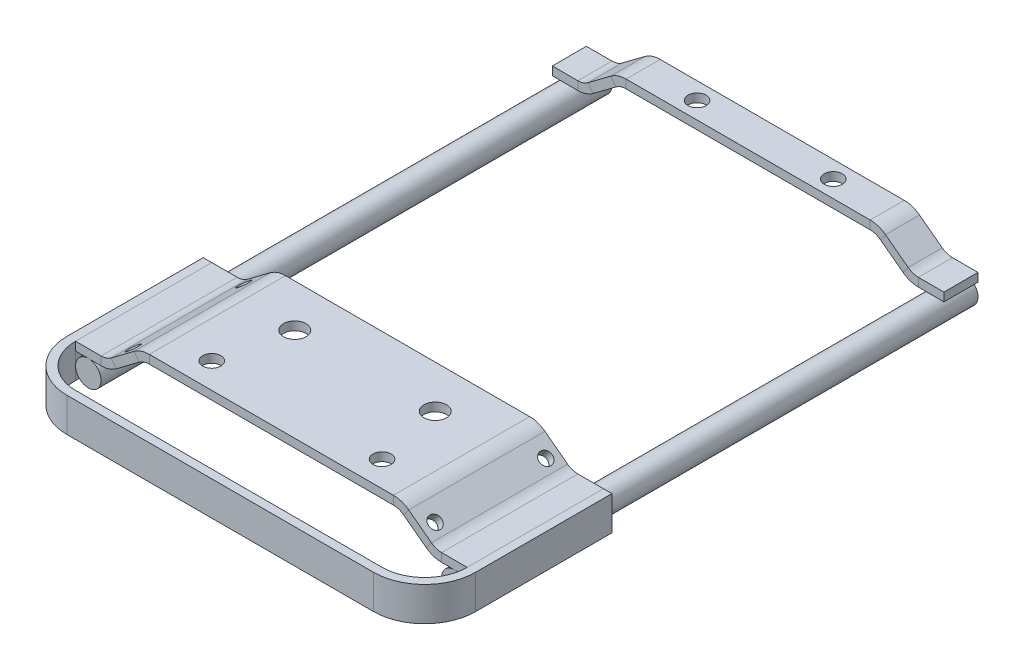
from build123d import *

# Parameters (mm, degrees)
BOSS_EXTRUDE1_DEPTH                     = 50.8
BOSS_EXTRUDE3_DEPTH                     = 12.7
SKETCH475_R                             = 4.7625
BOSS_EXTRUDE4_DEPTH                     = 190.5
BOSS_EXTRUDE4_2_DEPTH                   = 190.5
BOSS_EXTRUDE5_DEPTH                     = 12.7
SKETCH480_W                             = 4.2164
SKETCH480_H                             = 22.225
F_5_16_CLEARANCE_HOLE1_AT_2_COUNT       = 2
F_5_16_CLEARANCE_HOLE1_AT_2_PITCH       = 52.3875
SKETCH482_W                             = 3.3782
SKETCH482_H                             = 22.225
F_1_4_CLEARANCE_HOLE1_AT_2_COUNT        = 2
F_1_4_CLEARANCE_HOLE1_AT_2_PITCH        = 63.5
F_1_4_CLEARANCE_HOLE1_AT_3_COUNT        = 2
F_1_4_CLEARANCE_HOLE1_AT_3_PITCH        = 174.740416404
F_1_4_CLEARANCE_HOLE1_AT_4_COUNT        = 2
F_1_4_CLEARANCE_HOLE1_AT_4_PITCH        = 183.738980962
SKETCH484_W                             = 2.38125
SKETCH484_H                             = 83.185
F_3_16_0_1875_DIAMETER_HOLE1_AT_2_COUNT = 2
F_3_16_0_1875_DIAMETER_HOLE1_AT_2_PITCH = 41.275
MIRROR1_COPY_1_SKETCH_W                 = 2.38125
MIRROR1_COPY_1_SKETCH_H                 = 83.185
CONVERT_SOLID1_START                    = -50.8
CONVERT_SOLID1_DEPTH                    = 50.8
CONVERT_SOLID1_2_DEPTH                  = 50.8
CONVERT_SOLID2_START                    = -190.5
CONVERT_SOLID2_DEPTH                    = 12.7
CONVERT_SOLID2_2_DEPTH                  = 12.7


# Read off the part's stored shape, not the designer's step: Convert-Solid1, Convert-Solid2
with BuildPart() as part:
    # Sketch1 → Boss-Extrude1 (new body)
    with BuildSketch(Plane.XY):
        Polygon((0, 7.9375), (47.625, 7.9375), (60.325, -1.5875), (73.025, -1.5875), (73.025, 1.5875), (61.383333333, 1.5875), (48.683333333, 11.1125), (0, 11.1125), (-48.683333333, 11.1125), (-61.383333333, 1.5875), (-73.025, 1.5875), (-73.025, -1.5875), (-60.325, -1.5875), (-47.625, 7.9375), align=None)
    extrude(amount=-BOSS_EXTRUDE1_DEPTH)

    # Sketch480 → 5/16 Clearance Hole1 (revolve, cut)
    with BuildSketch(Plane(origin=(-26.19375, 11.1125, -34.925), x_dir=(0, 0, 1), z_dir=(1, 0, 0))):
        with Locations((2.1082, 11.1125)):
            Rectangle(SKETCH480_W, SKETCH480_H)
    f_5_16_clearance_hole1 = revolve(axis=Axis((-26.19375, 17.4625, -34.925), (0, -1, 0)), mode=Mode.SUBTRACT)

    # 5/16 Clearance Hole1 at 2: 5/16 Clearance Hole1 ×2
    with Locations(*[(i * F_5_16_CLEARANCE_HOLE1_AT_2_PITCH, 0, 0) for i in range(1, F_5_16_CLEARANCE_HOLE1_AT_2_COUNT)]):
        add(f_5_16_clearance_hole1, mode=Mode.SUBTRACT)

    # Sketch482 → 1/4 Clearance Hole1 (revolve, cut)
    with BuildSketch(Plane(origin=(-31.75, 11.1125, -9.525), x_dir=(0, 0, 1), z_dir=(1, 0, 0))):
        with Locations((1.6891, 11.1125)):
            Rectangle(SKETCH482_W, SKETCH482_H)
    f_1_4_clearance_hole1 = revolve(axis=Axis((-31.75, 17.4625, -9.525), (0, -1, 0)), mode=Mode.SUBTRACT)

    # 1/4 Clearance Hole1 at 2: 1/4 Clearance Hole1 ×2
    with Locations(*[(i * F_1_4_CLEARANCE_HOLE1_AT_2_PITCH, 0, 0) for i in range(1, F_1_4_CLEARANCE_HOLE1_AT_2_COUNT)]):
        add(f_1_4_clearance_hole1, mode=Mode.SUBTRACT)

    # Sketch484 → 3/16 (0.1875) Diameter Hole1 (revolve, cut)
    with BuildSketch(Plane(origin=(56.303333333, 5.3975, -46.0375), x_dir=(-0.7999999999999998, 0.6000000000000002, 0), z_dir=(0, 0, 1))):
        with Locations((1.190625, 41.5925)):
            Rectangle(SKETCH484_W, SKETCH484_H)
    f_3_16_0_1875_diameter_hole1 = revolve(axis=Axis((60.113333333, 10.4775, -46.0375), (-0.6000000000000003, -0.7999999999999998, 0)), mode=Mode.SUBTRACT)

    # 3/16 (0.1875) Diameter Hole1 at 2: 3/16 (0.1875) Diameter Hole1 ×2
    with Locations(*[(0, 0, i * F_3_16_0_1875_DIAMETER_HOLE1_AT_2_PITCH) for i in range(1, F_3_16_0_1875_DIAMETER_HOLE1_AT_2_COUNT)]):
        add(f_3_16_0_1875_diameter_hole1, mode=Mode.SUBTRACT)

    # Mirror1: 3/16 (0.1875) Diameter Hole1 across plane
    add(f_3_16_0_1875_diameter_hole1.mirror(Plane(origin=(0, 0, 0), x_dir=(0, 0, 1), z_dir=(1, 0, 0))), mode=Mode.SUBTRACT)

    # Mirror1 copy 1 sketch → Mirror1 copy 1 (revolve, cut)
    with BuildSketch(Plane(origin=(-56.303333333, 5.3975, -4.7625), x_dir=(0.7999999999999998, 0.6000000000000002, 0), z_dir=(0, 0, 1))):
        with Locations((1.190625, -41.5925)):
            Rectangle(MIRROR1_COPY_1_SKETCH_W, MIRROR1_COPY_1_SKETCH_H)
    revolve(axis=Axis((-60.113333333, 10.4775, -4.7625), (-0.6000000000000003, 0.7999999999999998, 0)), mode=Mode.SUBTRACT)

    # Convert-Solid1 outline → Convert-Solid1 (cut)
    with BuildSketch(Plane.XY.offset(CONVERT_SOLID1_START)):
        with BuildLine():
            ThreePointArc((63.5, -1.5875), (60.487930529, -1.098708414), (57.785, 0.3175))
            Line((57.785, 0.3175), (60.325, -1.5875))
            Line((60.325, -1.5875), (63.5, -1.5875))
        make_face()
        with BuildLine():
            Line((-60.325, -1.5875), (-57.785, 0.3175))
            ThreePointArc((-57.785, 0.3175), (-60.487930529, -1.098708414), (-63.5, -1.5875))
            Line((-63.5, -1.5875), (-60.325, -1.5875))
        make_face()
        with BuildLine():
            ThreePointArc((45.508333333, 11.1125), (48.520402804, 10.623708414), (51.223333333, 9.2075))
            Line((51.223333333, 9.2075), (48.683333333, 11.1125))
            Line((48.683333333, 11.1125), (45.508333333, 11.1125))
        make_face()
        with BuildLine():
            ThreePointArc((-51.223333333, 9.2075), (-48.520402804, 10.623708414), (-45.508333333, 11.1125))
            Line((-45.508333333, 11.1125), (-48.683333333, 11.1125))
            Line((-48.683333333, 11.1125), (-51.223333333, 9.2075))
        make_face()
    extrude(amount=CONVERT_SOLID1_DEPTH, mode=Mode.SUBTRACT)

    # Convert-Solid1 2 outline → Convert-Solid1 2 (add)
    with BuildSketch(Plane.XY.offset(CONVERT_SOLID1_START)):
        with BuildLine():
            Line((61.383333333, 1.5875), (63.5, 1.5875))
            ThreePointArc((63.5, 1.5875), (61.491953686, 1.913361057), (59.69, 2.8575))
            Line((59.69, 2.8575), (61.383333333, 1.5875))
        make_face()
        with BuildLine():
            ThreePointArc((45.508333333, 7.9375), (47.516379647, 7.611638943), (49.318333333, 6.6675))
            Line((49.318333333, 6.6675), (47.625, 7.9375))
            Line((47.625, 7.9375), (45.508333333, 7.9375))
        make_face()
        with BuildLine():
            Line((-47.625, 7.9375), (-49.318333333, 6.6675))
            ThreePointArc((-49.318333333, 6.6675), (-47.516379647, 7.611638943), (-45.508333333, 7.9375))
            Line((-45.508333333, 7.9375), (-47.625, 7.9375))
        make_face()
        with BuildLine():
            Line((-63.5, 1.5875), (-61.383333333, 1.5875))
            Line((-61.383333333, 1.5875), (-59.69, 2.8575))
            ThreePointArc((-59.69, 2.8575), (-61.491953686, 1.913361057), (-63.5, 1.5875))
        make_face()
    extrude(amount=CONVERT_SOLID1_2_DEPTH)


with BuildPart() as body_2:
    # Sketch474 → Boss-Extrude3 (new body)
    with BuildSketch(Plane(origin=(0, 1.5875, 0), x_dir=(1, 0, 0), z_dir=(0, 1, 0))):
        with BuildLine():
            Line((-73.025, 50.8), (-73.025, 0))
            ThreePointArc((-73.025, 0), (-68.375320151, -11.225320151), (-57.15, -15.875))
            Line((-57.15, -15.875), (57.15, -15.875))
            ThreePointArc((57.15, -15.875), (68.375320151, -11.225320151), (73.025, 0))
            Line((73.025, 0), (73.025, 50.8))
            Line((73.025, 50.8), (76.2, 50.8))
            Line((76.2, 50.8), (76.2, 0))
            ThreePointArc((76.2, 0), (70.620384182, -13.470384182), (57.15, -19.05))
            Line((57.15, -19.05), (-57.15, -19.05))
            ThreePointArc((-57.15, -19.05), (-70.620384182, -13.470384182), (-76.2, 0))
            Line((-76.2, 0), (-76.2, 50.8))
            Line((-76.2, 50.8), (-73.025, 50.8))
        make_face()
    extrude(amount=-BOSS_EXTRUDE3_DEPTH)


with BuildPart() as body_3:
    # Sketch475 → Boss-Extrude4 (new body)
    with BuildSketch(Plane.XY):
        with Locations((68.2625, -6.35)):
            Circle(SKETCH475_R)
    extrude(amount=-BOSS_EXTRUDE4_DEPTH)


with BuildPart() as body_4:
    # Sketch475 → Boss-Extrude4 2 (new body)
    with BuildSketch(Plane.XY):
        with Locations(Location((-68.2625, -6.35, 0), (0, 0, 180))):
            Circle(SKETCH475_R)
    extrude(amount=-BOSS_EXTRUDE4_2_DEPTH)


with BuildPart() as body_5:
    # Sketch477 → Boss-Extrude5 (new body)
    with BuildSketch(Plane(origin=(0, 0, -190.5), x_dir=(-1, 0, 0), z_dir=(0, 0, -1))):
        Polygon((-60.325, -1.5875), (-47.625, 7.9375), (47.625, 7.9375), (60.325, -1.5875), (73.025, -1.5875), (73.025, 1.5875), (61.383333333, 1.5875), (48.683333333, 11.1125), (-48.683333333, 11.1125), (-61.383333333, 1.5875), (-73.025, 1.5875), (-73.025, -1.5875), align=None)
    extrude(amount=-BOSS_EXTRUDE5_DEPTH)

    # 1/4 Clearance Hole1 at 3: 1/4 Clearance Hole1 ×2
    with Locations(*[Vector(0.03633961810714297, 0, -0.9993394979464322) * (i * F_1_4_CLEARANCE_HOLE1_AT_3_PITCH) for i in range(1, F_1_4_CLEARANCE_HOLE1_AT_3_COUNT)]):
        add(f_1_4_clearance_hole1, mode=Mode.SUBTRACT)

    # 1/4 Clearance Hole1 at 4: 1/4 Clearance Hole1 ×2
    with Locations(*[Vector(0.3110390604146254, 0, -0.9503971290446889) * (i * F_1_4_CLEARANCE_HOLE1_AT_4_PITCH) for i in range(1, F_1_4_CLEARANCE_HOLE1_AT_4_COUNT)]):
        add(f_1_4_clearance_hole1, mode=Mode.SUBTRACT)

    # Convert-Solid2 outline → Convert-Solid2 (cut)
    with BuildSketch(Plane.XY.offset(CONVERT_SOLID2_START)):
        with BuildLine():
            Line((48.683333333, 11.1125), (45.508333333, 11.1125))
            ThreePointArc((45.508333333, 11.1125), (48.520402804, 10.623708414), (51.223333333, 9.2075))
            Line((51.223333333, 9.2075), (48.683333333, 11.1125))
        make_face()
        with BuildLine():
            Line((-48.683333333, 11.1125), (-51.223333333, 9.2075))
            ThreePointArc((-51.223333333, 9.2075), (-48.520402804, 10.623708414), (-45.508333333, 11.1125))
            Line((-45.508333333, 11.1125), (-48.683333333, 11.1125))
        make_face()
        with BuildLine():
            ThreePointArc((63.5, -1.5875), (60.487930529, -1.098708414), (57.785, 0.3175))
            Line((57.785, 0.3175), (60.325, -1.5875))
            Line((60.325, -1.5875), (63.5, -1.5875))
        make_face()
        with BuildLine():
            ThreePointArc((-57.785, 0.3175), (-60.487930529, -1.098708414), (-63.5, -1.5875))
            Line((-63.5, -1.5875), (-60.325, -1.5875))
            Line((-60.325, -1.5875), (-57.785, 0.3175))
        make_face()
    extrude(amount=CONVERT_SOLID2_DEPTH, mode=Mode.SUBTRACT)

    # Convert-Solid2 2 outline → Convert-Solid2 2 (add)
    with BuildSketch(Plane.XY.offset(CONVERT_SOLID2_START)):
        with BuildLine():
            ThreePointArc((63.5, 1.5875), (61.491953686, 1.913361057), (59.69, 2.8575))
            Line((59.69, 2.8575), (61.383333333, 1.5875))
            Line((61.383333333, 1.5875), (63.5, 1.5875))
        make_face()
        with BuildLine():
            ThreePointArc((-59.69, 2.8575), (-61.491953686, 1.913361057), (-63.5, 1.5875))
            Line((-63.5, 1.5875), (-61.383333333, 1.5875))
            Line((-61.383333333, 1.5875), (-59.69, 2.8575))
        make_face()
        with BuildLine():
            Line((47.625, 7.9375), (45.508333333, 7.9375))
            ThreePointArc((45.508333333, 7.9375), (47.516379647, 7.611638943), (49.318333333, 6.6675))
            Line((49.318333333, 6.6675), (47.625, 7.9375))
        make_face()
        with BuildLine():
            Line((-47.625, 7.9375), (-49.318333333, 6.6675))
            ThreePointArc((-49.318333333, 6.6675), (-47.516379647, 7.611638943), (-45.508333333, 7.9375))
            Line((-45.508333333, 7.9375), (-47.625, 7.9375))
        make_face()
    extrude(amount=CONVERT_SOLID2_2_DEPTH)


solid = Compound([part.part, body_2.part, body_3.part, body_4.part, body_5.part])
